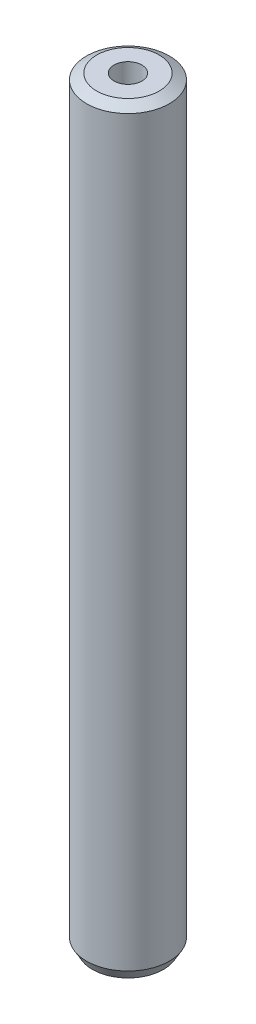
from build123d import *
from OCP.BRepFilletAPI import BRepFilletAPI_MakeChamfer

# Parameters (mm, degrees)
SKETCH1_R           = 22.5
BOSS_EXTRUDE1_DEPTH = 412.221045888
SKETCH2_R           = 7.566811245
CUT_EXTRUDE1_DEPTH  = 414.447325149
CHAMFER1_SIZE       = 3.191198619
CHAMFER1_SIZE2      = 5.527318144


with BuildPart() as part:
    # Sketch1 → Boss-Extrude1 (new body)
    with BuildSketch(Plane(origin=(0, 0, 0), x_dir=(1, 0, 0), z_dir=(0, 1, 0))):
        Circle(SKETCH1_R)
    extrude(amount=BOSS_EXTRUDE1_DEPTH)

    # Sketch2 → Cut-Extrude1 (cut, through all)
    with BuildSketch(Plane(origin=(0, 0, 0), x_dir=(1, 0, 0), z_dir=(0, 1, 0))):
        Circle(SKETCH2_R)
    extrude(amount=CUT_EXTRUDE1_DEPTH, mode=Mode.SUBTRACT)

    # Chamfer1: one chamfer whose edges measure the first distance from different faces: ONE call of the kernel's chamfer builder (chamfer() names one face for all edges)
    chamfer1_edges_1 = [part.edges().sort_by_distance(p)[0] for p in [
        (-22.5, 412.221045888, 0),
    ]]
    chamfer1_side_1 = [part.faces().sort_by_distance(p)[0] for p in [
        (-22.5, 206.110522944, 0),
    ]]
    chamfer1_edges_2 = [part.edges().sort_by_distance(p)[0] for p in [
        (-22.5, 0, 0),
    ]]
    chamfer1_side_2 = [part.faces().sort_by_distance(p)[0] for p in [
        (-21.863603897, 0, 0),
    ]]
    chamfer1 = BRepFilletAPI_MakeChamfer(part.part.solid().wrapped)
    for e in chamfer1_edges_1:
        chamfer1.Add(CHAMFER1_SIZE, CHAMFER1_SIZE2, e.wrapped, chamfer1_side_1[0].wrapped)  # the first distance lies on this face
    for e in chamfer1_edges_2:
        chamfer1.Add(CHAMFER1_SIZE, CHAMFER1_SIZE2, e.wrapped, chamfer1_side_2[0].wrapped)  # the first distance lies on this face
    add(Compound.cast(chamfer1.Shape()), mode=Mode.REPLACE)


solid = part.part
